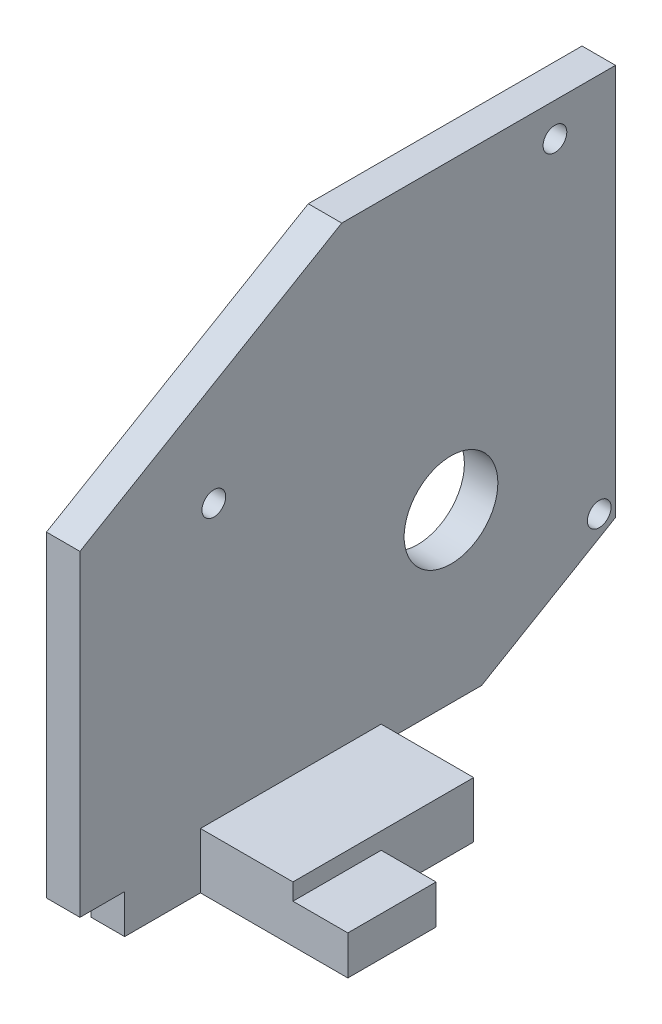
from build123d import *

# Parameters (mm, degrees)
SKETCH2_R           = 8.89
SKETCH2_R_2         = 2.2479
BOSS_EXTRUDE3_DEPTH = 6.35
SKETCH2_5_W         = 34.29
SKETCH2_5_H         = 10.584200066
BOSS_EXTRUDE4_DEPTH = 17.5514
SKETCH3_W           = 16.74
SKETCH3_H           = 7.409200066
BOSS_EXTRUDE5_DEPTH = 10.414


with BuildPart() as part:
    # Sketch2 → Boss-Extrude3 (new body)
    with BuildSketch(Plane(origin=(0, 0, 0), x_dir=(0, 0, -1), z_dir=(1, 0, 0))):
        Polygon((0, 60.133916205), (0, 0), (8.480621378, 0), (8.480621378, -7.409200066), (57.15, -7.409200066), (57.15, 0), (76.2, 0), (101.61105835, 14.893448342), (101.61105835, 89.193223315), (49.670010733, 89.245562356), align=None)
        with Locations((70.400428115, 31.75)):
            Circle(SKETCH2_R, mode=Mode.SUBTRACT)
        with Locations((98.525695687, 17.018)):
            Circle(SKETCH2_R_2, mode=Mode.SUBTRACT)
        with Locations((25.4, 55.3212)):
            Circle(SKETCH2_R_2, mode=Mode.SUBTRACT)
        with Locations((90.119204984, 82.8548)):
            Circle(SKETCH2_R_2, mode=Mode.SUBTRACT)
    extrude(amount=-BOSS_EXTRUDE3_DEPTH)

    # Sketch2<5> → Boss-Extrude4 (add)
    with BuildSketch(Plane(origin=(0, 0, 0), x_dir=(0, 0, -1), z_dir=(1, 0, 0))):
        with Locations((40.005, -2.117100033)):
            Rectangle(SKETCH2_5_W, SKETCH2_5_H)
    extrude(amount=BOSS_EXTRUDE4_DEPTH)

    # Sketch3 → Boss-Extrude5 (add)
    with BuildSketch(Plane(origin=(17.5514, 0, 0), x_dir=(0, 0, -1), z_dir=(1, 0, 0))):
        with Locations((31.23, -3.704600033)):
            Rectangle(SKETCH3_W, SKETCH3_H)
    extrude(amount=BOSS_EXTRUDE5_DEPTH)


solid = part.part
